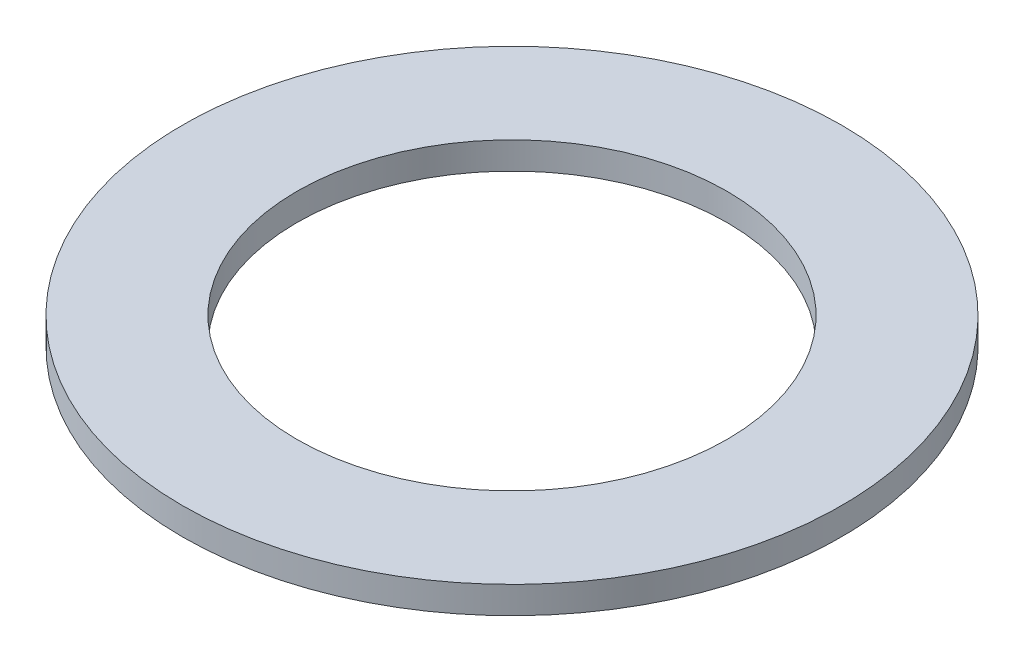
from build123d import *

# Parameters (mm, degrees)
SKETCH1_R           = 22.225
SKETCH1_R_2         = 14.5
BOSS_EXTRUDE1_DEPTH = 1.8288


with BuildPart() as part:
    # Sketch1 → Boss-Extrude1 (new body)
    with BuildSketch(Plane(origin=(0, 0, 0), x_dir=(1, 0, 0), z_dir=(0, 1, 0))):
        Circle(SKETCH1_R)
        Circle(SKETCH1_R_2, mode=Mode.SUBTRACT)
    extrude(amount=BOSS_EXTRUDE1_DEPTH)


solid = part.part
